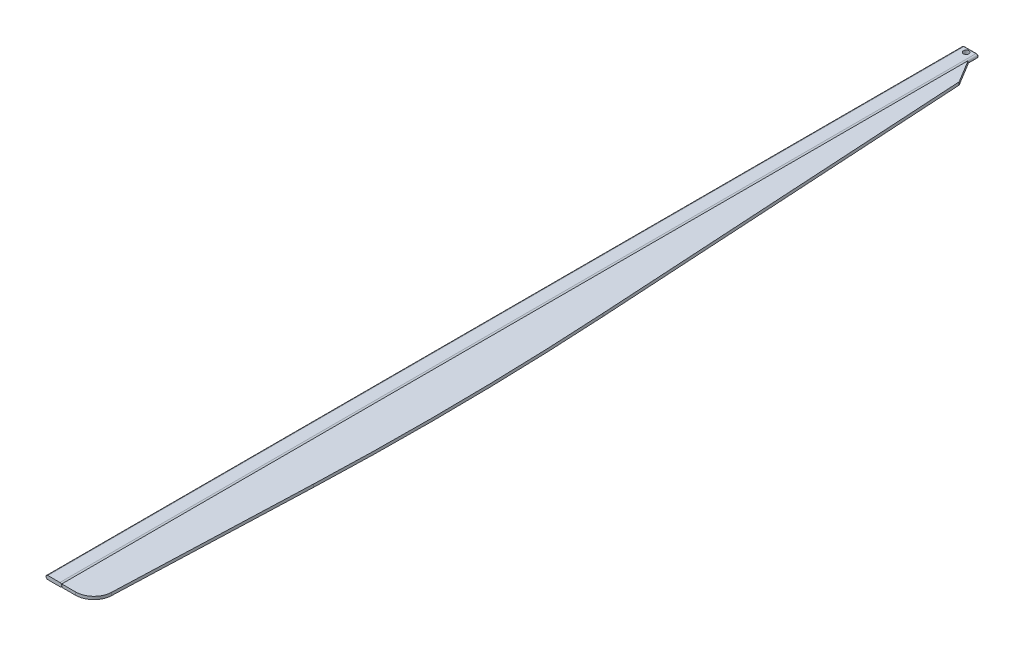
from build123d import *

# Parameters (mm, degrees)
SKETCH4_R                = 75
CUT_EXTRUDE1_DEPTH       = 25002.124474711
FILLET1_R                = 20
BOSS_EXTRUDE1_DEPTH      = 40
BOSS_EXTRUDE1_DEPTH_BACK = 40


with BuildPart() as part:
    # Sweep1: sweep along a path in Sketch2
    with BuildLine(Plane(origin=(0, 0, 0), x_dir=(1, 0, 0), z_dir=(0, 1, 0))) as sweep1_path:
        Line((0, 0), (0, -25000))
    # Sketch1 → Sweep1 (sweep)
    with BuildSketch(Plane.XY):
        with BuildLine():
            Line((-165, 50), (165, 50))
            ThreePointArc((165, 50), (215, 0), (165, -50))
            Line((165, -50), (-165, -50))
            ThreePointArc((-165, -50), (-215, 0), (-165, 50))
        make_face()
    sweep(path=sweep1_path.line)

    # Sketch4 → Cut-Extrude1 (cut, through all)
    with BuildSketch(Plane(origin=(0, 50, 0), x_dir=(1, 0, 0), z_dir=(0, 1, 0))):
        with Locations((0, -120)):
            Circle(SKETCH4_R)
    extrude(amount=-CUT_EXTRUDE1_DEPTH, mode=Mode.SUBTRACT)

    # Fillet1
    fillet1_edges = [part.edges().sort_by_distance(p)[0] for p in [
        (0, 50, 0),
        (215, 0, 0),
        (0, -50, 0),
        (-215, 0, 0),
    ]]
    fillet(fillet1_edges, radius=FILLET1_R)


with BuildPart() as body_2:
    # Sketch3 → Boss-Extrude1 (new, two sides: drawn at the far end of the back side and taken through both)
    with BuildSketch(Plane(origin=(0, 0, 0), x_dir=(1, 0, 0), z_dir=(0, 1, 0)).offset(-BOSS_EXTRUDE1_DEPTH_BACK)):
        with BuildLine():
            Line((215, -281.209140276), (591.052452888, -901.524429756))
            Line((591.052452888, -901.524429756), (1200.851543386, -11226.079055967))
            ThreePointArc((1200.851543386, -11226.079055967), (1340.354422594, -15214.36481836), (1288.088555363, -19204.747338236))
            Line((1288.088555363, -19204.747338236), (1090.707874725, -24518.559618227))
            ThreePointArc((1090.707874725, -24518.559618227), (937.98197807, -24860.05541873), (591.052452888, -25000))
            Line((591.052452888, -25000), (215, -25000))
            Line((215, -25000), (215, -281.209140276))
        make_face()
    extrude(amount=BOSS_EXTRUDE1_DEPTH + BOSS_EXTRUDE1_DEPTH_BACK)


solid = Compound([part.part, body_2.part])
